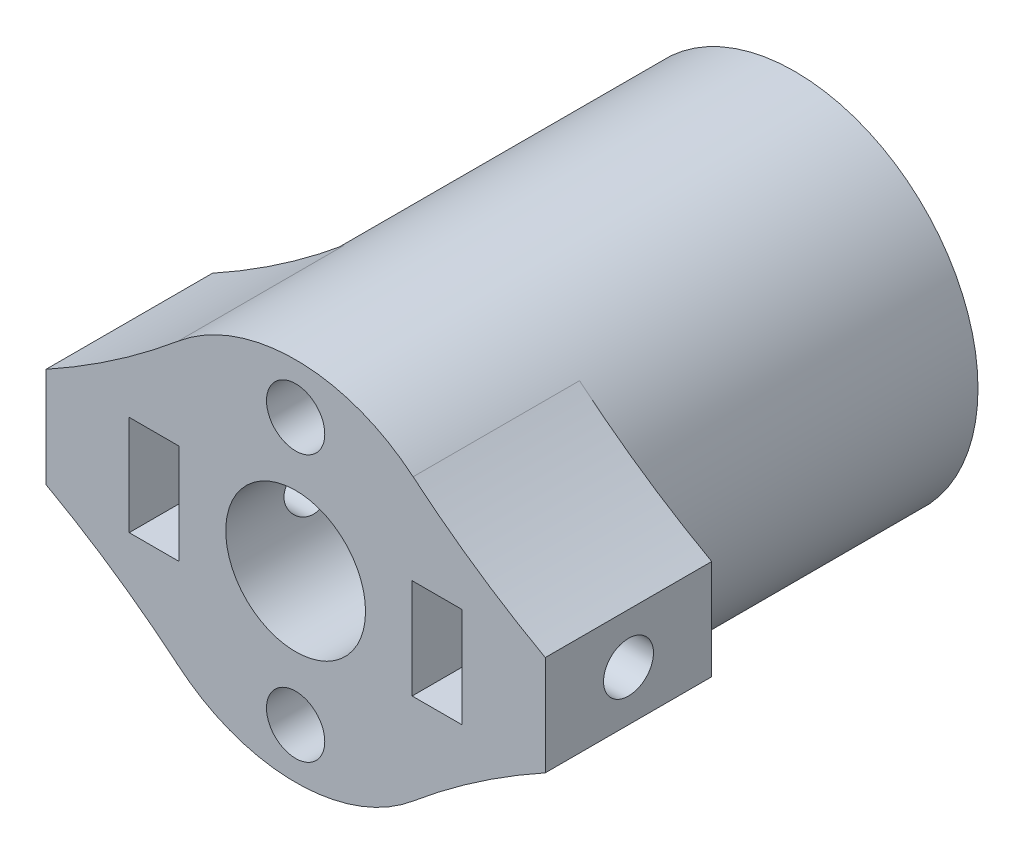
from build123d import *

# Parameters (mm, degrees)
SKETCH1_R               = 11
SKETCH1_R_2             = 1.75
BOSS_EXTRUDE1_DEPTH     = 19
BOSS_EXTRUDE2_START     = 11
SKETCH2_R               = 11
SKETCH2_R_2             = 1.75
BOSS_EXTRUDE2_DEPTH     = 11
CUT_EXTRUDE3_DEPTH      = 20
SKETCH7_R               = 5
CUT_EXTRUDE4_DEPTH      = 5
SKETCH8_R               = 2.2
CUT_EXTRUDE5_DEPTH      = 5
BOSS_EXTRUDE3_DEPTH     = 20
SKETCH11_W              = 3
SKETCH11_H              = 6
CUT_EXTRUDE6_DEPTH      = 10
CUT_EXTRUDE7_DEPTH      = 25.556058316
CUT_EXTRUDE7_DEPTH_BACK = 25.556058316
SKETCH12_R              = 1.5
SKETCH13_W              = 10
SKETCH13_H              = 6
SKETCH13_R              = 1.5
BOSS_EXTRUDE4_DEPTH     = 5
FILLET1_R               = 50


with BuildPart() as part:
    # Sketch1 → Boss-Extrude1 (new body)
    with BuildSketch(Plane.XY):
        Circle(SKETCH1_R)
        with Locations((0, 8)):
            Circle(SKETCH1_R_2, mode=Mode.SUBTRACT)
        with Locations((0, -8)):
            Circle(SKETCH1_R_2, mode=Mode.SUBTRACT)
    extrude(amount=BOSS_EXTRUDE1_DEPTH)

    # Sketch2 → Boss-Extrude2 (add)
    with BuildSketch(Plane(origin=(0, 0, 0), x_dir=(-1, 0, 0), z_dir=(0, 0, -1)).offset(BOSS_EXTRUDE2_START)):
        Circle(SKETCH2_R)
        with Locations((0, 8)):
            Circle(SKETCH2_R_2, mode=Mode.SUBTRACT)
        with Locations((0, -8)):
            Circle(SKETCH2_R_2, mode=Mode.SUBTRACT)
    extrude(amount=-BOSS_EXTRUDE2_DEPTH)

    # Sketch6 → Cut-Extrude3 (cut)
    with BuildSketch(Plane.XY.offset(19)):
        with BuildLine():
            Line((-4.079215611, 1), (-5, 1))
            Line((-5, 1), (-5, -1))
            Line((-5, -1), (-4.079215611, -1))
            ThreePointArc((-4.079215611, -1), (4.2, 0), (-4.079215611, 1))
        make_face()
    extrude(amount=-CUT_EXTRUDE3_DEPTH, mode=Mode.SUBTRACT)

    # Sketch7 → Cut-Extrude4 (cut)
    with BuildSketch(Plane(origin=(0, 0, -11), x_dir=(-1, 0, 0), z_dir=(0, 0, -1))):
        Circle(SKETCH7_R)
    extrude(amount=-CUT_EXTRUDE4_DEPTH, mode=Mode.SUBTRACT)

    # Sketch8 → Cut-Extrude5 (cut)
    with BuildSketch(Plane(origin=(0, 0, -6), x_dir=(-1, 0, 0), z_dir=(0, 0, -1))):
        Circle(SKETCH8_R)
    extrude(amount=-CUT_EXTRUDE5_DEPTH, mode=Mode.SUBTRACT)

    # Sketch9 → Boss-Extrude3 (add)
    with BuildSketch(Plane.XY.offset(19)):
        with BuildLine():
            Line((-5, -1), (-4.079215611, -1))
            ThreePointArc((-4.079215611, -1), (-4.2, 0), (-4.079215611, 1))
            Line((-4.079215611, 1), (-5, 1))
            Line((-5, 1), (-5, -1))
        make_face()
    extrude(amount=-BOSS_EXTRUDE3_DEPTH)

    # Sketch11 → Cut-Extrude6 (cut)
    with BuildSketch(Plane.XY.offset(19)):
        with Locations((-8.5, 0)):
            Rectangle(SKETCH11_W, SKETCH11_H)
        with Locations((8.5, 0)):
            Rectangle(SKETCH11_W, SKETCH11_H)
    extrude(amount=-CUT_EXTRUDE6_DEPTH, mode=Mode.SUBTRACT)

    # Sketch12 → Cut-Extrude7 (cut, two sides: drawn at the far end of the back side and taken through both)
    with BuildSketch(Plane(origin=(0, 0, 0), x_dir=(0, 0, -1), z_dir=(1, 0, 0)).offset(-CUT_EXTRUDE7_DEPTH_BACK)):
        with Locations((-14, 0)):
            Circle(SKETCH12_R)
    extrude(amount=CUT_EXTRUDE7_DEPTH + CUT_EXTRUDE7_DEPTH_BACK, mode=Mode.SUBTRACT)

    # Sketch13 → Boss-Extrude4 (add)
    with BuildSketch(Plane.ZY.offset(-10)):
        with Locations((14, 0)):
            Rectangle(SKETCH13_W, SKETCH13_H)
        with Locations(Location((14, 0, 0), (0, 0, 180))):
            Circle(SKETCH13_R, mode=Mode.SUBTRACT)
    boss_extrude4 = extrude(amount=-BOSS_EXTRUDE4_DEPTH)

    # Mirror1: Boss-Extrude4 across plane
    add(boss_extrude4.mirror(Plane(origin=(0, 0, 0), x_dir=(0, 0, 1), z_dir=(1, 0, 0))))

    # Fillet1
    # the kernel refuses this fillet: 50 mm, written as the material it adds along each edge
    with BuildSketch(Plane(origin=(-10.583005244, -3, 19), x_dir=(0.5439709687724876, -0.8391040371328942, 0), z_dir=(0, 0, -1)), Plane(origin=(10.583005244, 3, 19), x_dir=(-0.5439709687724888, 0.8391040371328933, 0), z_dir=(0, 0, -1))) as fillet1_piece_1:
        with BuildLine():
            CenterArc((21.204232389, 47.782524235), FILLET1_R, 241.826767434, 11.045481443)
            Line((-2.402716916, 3.706318132), (0, 0))
            ThreePointArc((0, 0), (3.239535504, 0.487844668), (6.479071008, 0))
        make_face()
    extrude(amount=10)
    with BuildSketch(Plane(origin=(-10.583005244, 3, 19), x_dir=(0.5439709687724879, 0.839104037132894, 0), z_dir=(0, 0, -1)), Plane(origin=(10.583005244, -3, 19), x_dir=(-0.5439709687724888, -0.8391040371328933, 0), z_dir=(0, 0, -1))) as fillet1_piece_2:
        with BuildLine():
            CenterArc((21.204232389, -47.782524235), FILLET1_R, 107.127751124, 11.045481443)
            Line((-2.402716916, -3.706318132), (0, 0))
            ThreePointArc((0, 0), (3.239535504, -0.487844668), (6.479071008, 0))
        make_face()
    extrude(amount=10)


solid = part.part
